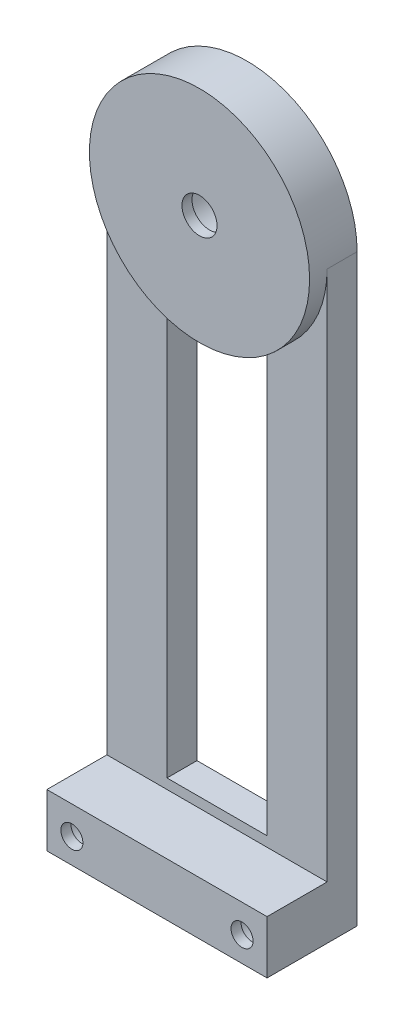
from build123d import *
from build123d.topology import SkipClean

# Parameters (mm, degrees)
BOSS_EXTRUDE1_DEPTH           = 3
BOSS_EXTRUDE2_START           = -1.75
SKETCH1_3_R                   = 11
BOSS_EXTRUDE2_DEPTH           = 1.75
SKETCH2_R                     = 1.75
CUT_EXTRUDE1_DEPTH            = 4.75
SKETCH2_3_R                   = 3
CUT_EXTRUDE2_DEPTH            = 3.75
SKETCH1_6_W                   = 11
SKETCH1_6_H                   = 5.31
BOSS_EXTRUDE3_DEPTH           = 6
SKETCH3_R                     = 1.1
CUT_EXTRUDE3_DEPTH            = 9
SKETCH3_3_R                   = 2
SKETCH3_3_R_2                 = 1.1
CUT_EXTRUDE4_DEPTH            = 8
BODY_MOVE_COPY1_START         = -3
BODY_MOVE_COPY1_OUTLINE_R     = 3
BODY_MOVE_COPY1_DEPTH         = 3
BODY_MOVE_COPY1_START_2       = 3
BODY_MOVE_COPY1_2_OUTLINE_W   = 22
BODY_MOVE_COPY1_2_OUTLINE_H   = 5.31
BODY_MOVE_COPY1_2_OUTLINE_R   = 2
BODY_MOVE_COPY1_2_DEPTH       = 3
BODY_MOVE_COPY1_START_3       = 0.75
BODY_MOVE_COPY1_3_OUTLINE_R   = 3
BODY_MOVE_COPY1_3_OUTLINE_R_2 = 1.75
BODY_MOVE_COPY1_3_DEPTH       = 1
BODY_MOVE_COPY1_START_4       = 5
BODY_MOVE_COPY1_4_OUTLINE_R   = 2
BODY_MOVE_COPY1_4_OUTLINE_R_2 = 1.1
BODY_MOVE_COPY1_4_DEPTH       = 1
BODY_MOVE_COPY1_5_DEPTH       = 3
BODY_MOVE_COPY1_START_5       = 1.75
BODY_MOVE_COPY1_6_OUTLINE_R   = 11
BODY_MOVE_COPY1_6_OUTLINE_R_2 = 3
BODY_MOVE_COPY1_6_DEPTH       = 1.25
BODY_MOVE_COPY1_START_6       = -6
BODY_MOVE_COPY1_7_OUTLINE_W   = 22
BODY_MOVE_COPY1_7_OUTLINE_H   = 5.31
BODY_MOVE_COPY1_7_OUTLINE_R   = 1.1
BODY_MOVE_COPY1_7_DEPTH       = 3
BODY_MOVE_COPY1_START_7       = -1.75
BODY_MOVE_COPY1_8_OUTLINE_R   = 3
BODY_MOVE_COPY1_8_OUTLINE_R_2 = 1.75
BODY_MOVE_COPY1_8_DEPTH       = 1


# Read off the part's stored shape, not the designer's step: Body-Move/Copy1
with BuildPart() as part:
    # Sketch1 → Boss-Extrude1 (new body)
    with BuildSketch(Plane.XY):
        with BuildLine():
            Line((-11, 29.175), (-11, -29.175))
            Line((-11, -29.175), (11, -29.175))
            Line((11, -29.175), (11, 29.175))
            ThreePointArc((11, 29.175), (0, 40.175), (-11, 29.175))
        make_face()
        with BuildLine():
            Line((5, -22.865), (-5, -22.865))
            Line((-5, -22.865), (-5, 18.818842411))
            ThreePointArc((-5, 18.818842411), (0, 17.675), (5, 18.818842411))
            Line((5, 18.818842411), (5, -22.865))
        make_face(mode=Mode.SUBTRACT)
    extrude(amount=BOSS_EXTRUDE1_DEPTH)

    # Sketch1<3> → Boss-Extrude2 (add)
    with BuildSketch(Plane.XY.offset(BOSS_EXTRUDE2_START)):
        with Locations((0, 29.175)):
            Circle(SKETCH1_3_R)
    extrude(amount=BOSS_EXTRUDE2_DEPTH)

    # Sketch2 → Cut-Extrude1 (cut)
    with BuildSketch(Plane.XY.offset(3)):
        with Locations((0, 29.175)):
            Circle(SKETCH2_R)
    extrude(amount=-CUT_EXTRUDE1_DEPTH, mode=Mode.SUBTRACT)

    # Sketch2<3> → Cut-Extrude2 (cut)
    with BuildSketch(Plane.XY.offset(3)):
        with Locations((0, 29.175)):
            Circle(SKETCH2_3_R)
    extrude(amount=-CUT_EXTRUDE2_DEPTH, mode=Mode.SUBTRACT)

    # Sketch1<6> → Boss-Extrude3 (add)
    with BuildSketch(Plane.XY):
        with Locations((5.5, -26.52)):
            Rectangle(SKETCH1_6_W, SKETCH1_6_H)
        with Locations((-5.5, -26.52)):
            Rectangle(SKETCH1_6_W, SKETCH1_6_H)
    extrude(amount=-BOSS_EXTRUDE3_DEPTH)

    # Sketch3 → Cut-Extrude3 (cut)
    with BuildSketch(Plane.XY.offset(3)):
        with Locations((-8.5, -26.67999607)):
            Circle(SKETCH3_R)
        with Locations((8.5, -26.67999607)):
            Circle(SKETCH3_R)
    extrude(amount=-CUT_EXTRUDE3_DEPTH, mode=Mode.SUBTRACT)

    # Sketch3<3> → Cut-Extrude4 (cut)
    # profile 1 of 2: a face of its own
    with BuildSketch(Plane.XY.offset(3)):
        with Locations((-8.5, -26.67999607)):
            Circle(SKETCH3_3_R)
        with Locations((-8.5, -26.67999607)):
            Circle(SKETCH3_3_R_2, mode=Mode.SUBTRACT)
    # profile 2 of 2: a face of its own
    with BuildSketch(Plane.XY.offset(3)):
        with Locations((8.5, -26.67999607)):
            Circle(SKETCH3_3_R)
        with Locations((8.5, -26.67999607)):
            Circle(SKETCH3_3_R_2, mode=Mode.SUBTRACT)
    extrude(amount=-CUT_EXTRUDE4_DEPTH, mode=Mode.SUBTRACT)

    # Body-Move/Copy1 outline → Body-Move/Copy1 (add)
    with BuildSketch(Plane.XY.offset(BODY_MOVE_COPY1_START)):
        with BuildLine():
            Line((-11, 29.175), (-11, -23.865))
            Line((-11, -23.865), (11, -23.865))
            Line((11, -23.865), (11, 29.175))
            ThreePointArc((11, 29.175), (0, 40.175), (-11, 29.175))
        make_face()
        with BuildLine():
            Line((-5, -22.865), (-5, 18.818842411))
            ThreePointArc((-5, 18.818842411), (0, 17.675), (5, 18.818842411))
            Line((5, 18.818842411), (5, -22.865))
            Line((5, -22.865), (-5, -22.865))
        make_face(mode=Mode.SUBTRACT)
        with Locations((0, 29.175)):
            Circle(BODY_MOVE_COPY1_OUTLINE_R, mode=Mode.SUBTRACT)
    extrude(amount=BODY_MOVE_COPY1_DEPTH)

    # Body-Move_Copy1 2 outline → Body-Move_Copy1 2 (add)
    with BuildSketch(Plane.XY.offset(BODY_MOVE_COPY1_START_2)):
        with Locations((0, -26.52)):
            Rectangle(BODY_MOVE_COPY1_2_OUTLINE_W, BODY_MOVE_COPY1_2_OUTLINE_H)
        with Locations((-8.5, -26.67999607)):
            Circle(BODY_MOVE_COPY1_2_OUTLINE_R, mode=Mode.SUBTRACT)
        with Locations((8.5, -26.67999607)):
            Circle(BODY_MOVE_COPY1_2_OUTLINE_R, mode=Mode.SUBTRACT)
    extrude(amount=BODY_MOVE_COPY1_2_DEPTH)

    # Body-Move_Copy1 3 outline → Body-Move_Copy1 3 (add)
    with BuildSketch(Plane.XY.offset(BODY_MOVE_COPY1_START_3)):
        with Locations((0, 29.175)):
            Circle(BODY_MOVE_COPY1_3_OUTLINE_R)
        with Locations((0, 29.175)):
            Circle(BODY_MOVE_COPY1_3_OUTLINE_R_2, mode=Mode.SUBTRACT)
    extrude(amount=BODY_MOVE_COPY1_3_DEPTH)

    # Body-Move_Copy1 4 outline → Body-Move_Copy1 4 (add)
    # profile 1 of 2: a face of its own
    with BuildSketch(Plane.XY.offset(BODY_MOVE_COPY1_START_4)):
        with Locations((-8.5, -26.67999607)):
            Circle(BODY_MOVE_COPY1_4_OUTLINE_R)
        with Locations((-8.5, -26.67999607)):
            Circle(BODY_MOVE_COPY1_4_OUTLINE_R_2, mode=Mode.SUBTRACT)
    # profile 2 of 2: a face of its own
    with BuildSketch(Plane.XY.offset(BODY_MOVE_COPY1_START_4)):
        with Locations((8.5, -26.67999607)):
            Circle(BODY_MOVE_COPY1_4_OUTLINE_R)
        with Locations((8.5, -26.67999607)):
            Circle(BODY_MOVE_COPY1_4_OUTLINE_R_2, mode=Mode.SUBTRACT)
    extrude(amount=BODY_MOVE_COPY1_4_DEPTH)

    # Body-Move_Copy1 5 outline → Body-Move_Copy1 5 (cut)
    with SkipClean():  # the faces are left unmerged after this step: merging them gives an invalid solid
        with BuildSketch(Plane.XY):
            with BuildLine():
                Line((-11, 29.175), (-11, -23.865))
                Line((-11, -23.865), (11, -23.865))
                Line((11, -23.865), (11, 29.175))
                ThreePointArc((11, 29.175), (0, 18.175), (-11, 29.175))
            make_face()
            with BuildLine():
                Line((-5, -22.865), (-5, 18.818842411))
                ThreePointArc((-5, 18.818842411), (0, 17.675), (5, 18.818842411))
                Line((5, 18.818842411), (5, -22.865))
                Line((5, -22.865), (-5, -22.865))
            make_face(mode=Mode.SUBTRACT)
        extrude(amount=BODY_MOVE_COPY1_5_DEPTH, mode=Mode.SUBTRACT)

    # Body-Move_Copy1 6 outline → Body-Move_Copy1 6 (cut)
    with BuildSketch(Plane.XY.offset(BODY_MOVE_COPY1_START_5)):
        with Locations((0, 29.175)):
            Circle(BODY_MOVE_COPY1_6_OUTLINE_R)
        with Locations((0, 29.175)):
            Circle(BODY_MOVE_COPY1_6_OUTLINE_R_2, mode=Mode.SUBTRACT)
    extrude(amount=BODY_MOVE_COPY1_6_DEPTH, mode=Mode.SUBTRACT)

    # Body-Move_Copy1 7 outline → Body-Move_Copy1 7 (cut)
    with BuildSketch(Plane.XY.offset(BODY_MOVE_COPY1_START_6)):
        with Locations((0, -26.52)):
            Rectangle(BODY_MOVE_COPY1_7_OUTLINE_W, BODY_MOVE_COPY1_7_OUTLINE_H)
        with Locations((-8.5, -26.67999607)):
            Circle(BODY_MOVE_COPY1_7_OUTLINE_R, mode=Mode.SUBTRACT)
        with Locations((8.5, -26.67999607)):
            Circle(BODY_MOVE_COPY1_7_OUTLINE_R, mode=Mode.SUBTRACT)
    extrude(amount=BODY_MOVE_COPY1_7_DEPTH, mode=Mode.SUBTRACT)

    # Body-Move_Copy1 8 outline → Body-Move_Copy1 8 (cut)
    with SkipClean():  # the faces are left unmerged after this step: merging them gives an invalid solid
        with BuildSketch(Plane.XY.offset(BODY_MOVE_COPY1_START_7)):
            with Locations((0, 29.175)):
                Circle(BODY_MOVE_COPY1_8_OUTLINE_R)
            with Locations((0, 29.175)):
                Circle(BODY_MOVE_COPY1_8_OUTLINE_R_2, mode=Mode.SUBTRACT)
        extrude(amount=BODY_MOVE_COPY1_8_DEPTH, mode=Mode.SUBTRACT)
    add(part.part.scale(1), mode=Mode.REPLACE)  # the faces are merged on a copy


solid = part.part
